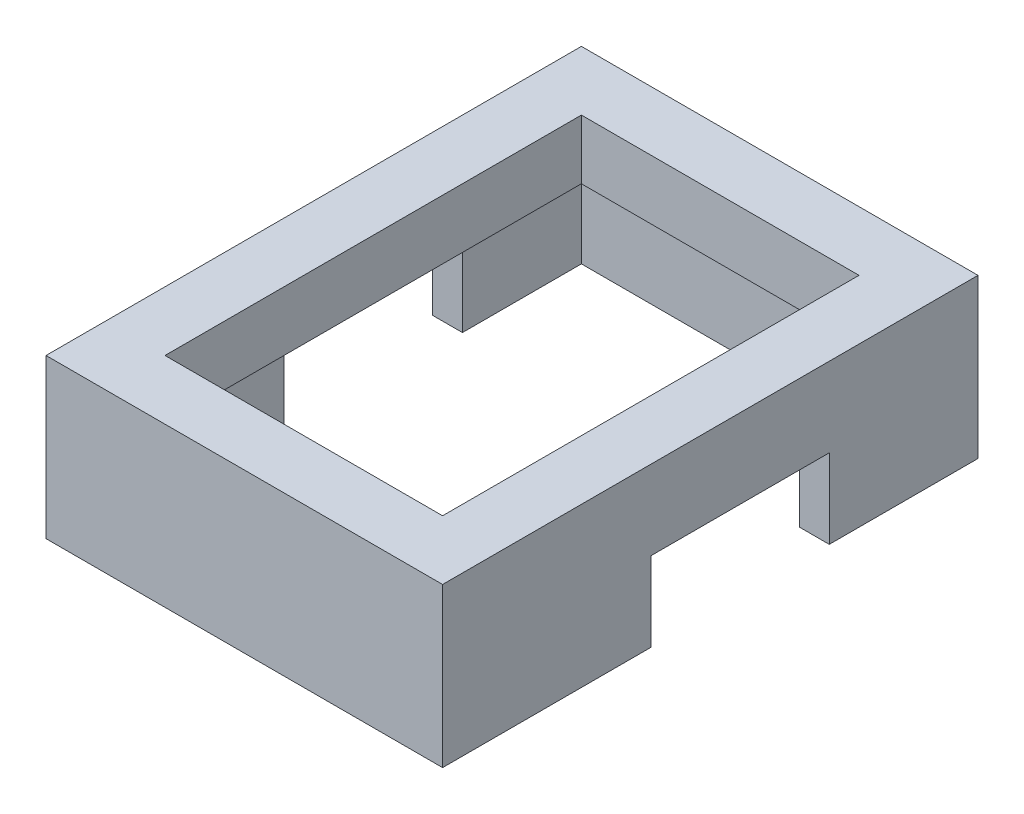
from build123d import *

# Parameters (mm, degrees)
SKETCH1_W           = 20
SKETCH1_H           = 27
BOSS_EXTRUDE1_DEPTH = 8
SKETCH2_W           = 9
SKETCH2_H           = 4
CUT_EXTRUDE1_DEPTH  = 20
SKETCH3_W           = 17
SKETCH3_H           = 24
CUT_EXTRUDE2_DEPTH  = 5
SKETCH4_W           = 14
SKETCH4_H           = 21
CUT_EXTRUDE3_DEPTH  = 7


with BuildPart() as part:
    # Sketch1 → Boss-Extrude1 (new body)
    with BuildSketch(Plane(origin=(0, 0, 0), x_dir=(1, 0, 0), z_dir=(0, 1, 0))):
        with Locations((-10.903225806, -3.629032258)):
            Rectangle(SKETCH1_W, SKETCH1_H)
    extrude(amount=BOSS_EXTRUDE1_DEPTH)

    # Sketch2 → Cut-Extrude1 (cut)
    with BuildSketch(Plane.ZY.offset(20.903225806)):
        with Locations((2.129032258, 2)):
            Rectangle(SKETCH2_W, SKETCH2_H)
    extrude(amount=-CUT_EXTRUDE1_DEPTH, mode=Mode.SUBTRACT)

    # Sketch3 → Cut-Extrude2 (cut)
    with BuildSketch(Plane.XZ):
        with Locations((-10.903225806, 3.629032258)):
            Rectangle(SKETCH3_W, SKETCH3_H)
    extrude(amount=-CUT_EXTRUDE2_DEPTH, mode=Mode.SUBTRACT)

    # Sketch4 → Cut-Extrude3 (cut)
    with BuildSketch(Plane(origin=(0, 8, 0), x_dir=(1, 0, 0), z_dir=(0, 1, 0))):
        with Locations((-10.903225806, -3.629032258)):
            Rectangle(SKETCH4_W, SKETCH4_H)
    extrude(amount=-CUT_EXTRUDE3_DEPTH, mode=Mode.SUBTRACT)


solid = part.part
